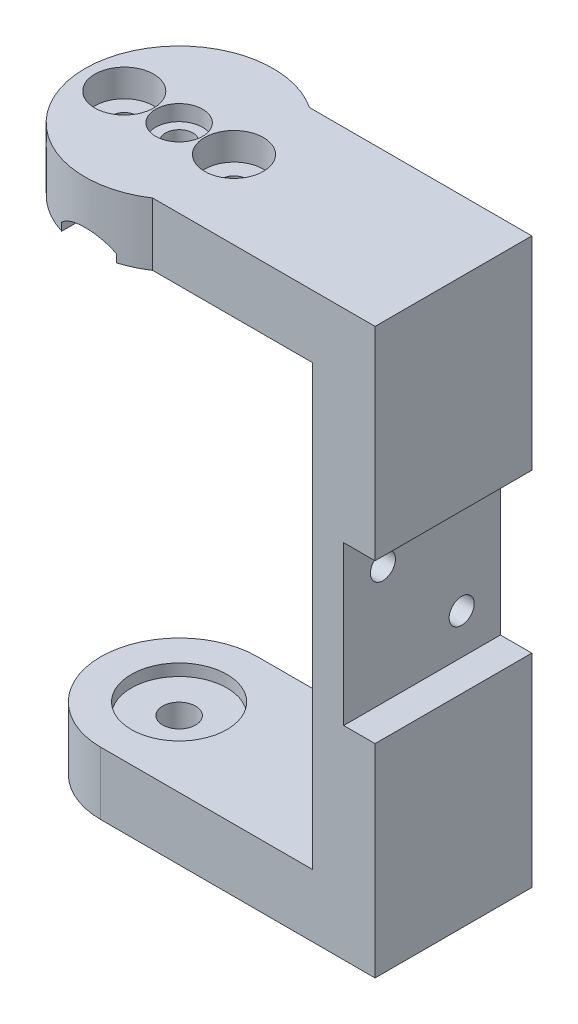
from build123d import *

# Parameters (mm, degrees)
SZKIC1_W                        = 45
SZKIC1_H                        = 20
SZKIC1_R                        = 2.1
DODANIE_WYCI_GNI_CIE1_DEPTH     = 8
SZKIC2_R                        = 6.1
WYTNIJ_WYCI_GNI_CIE1_DEPTH      = 1.5
WYTNIJ_WYCI_GNI_CIE2_START      = -1.5
SZKIC3_R                        = 6.1
WYTNIJ_WYCI_GNI_CIE2_DEPTH      = 1.5
SZKIC4_W                        = 8
SZKIC4_H                        = 20
DODANIE_WYCI_GNI_CIE2_DEPTH     = 56
ZAOKR_GLENIE1_R                 = 10
DODANIE_WYCI_GNI_CIE3_DEPTH     = 8
WYTNIJ_WYCI_GNI_CIE3_REACH      = 82.951
SZKIC6_R                        = 1.6
SZKIC7_R                        = 3.75
WYTNIJ_WYCI_GNI_CIE4_DEPTH      = 3.5
WYTNIJ_WYCI_GNI_CIE5_REACH      = 85.576
WYTNIJ_WYCI_GNI_CIE5_END_RADIUS = 12
SZKIC10_R                       = 3
WYTNIJ_WYCI_GNI_CIE6_DEPTH      = 2
WYTNIJ_WYCI_GNI_CIE7_REACH      = 81.177
WYTNIJ_WYCI_GNI_CIE7_END_RADIUS = 5
SZKIC11_R                       = 1.75
SZKIC12_W                       = 20
SZKIC12_H                       = 20.2
WYTNIJ_WYCI_GNI_CIE8_DEPTH      = 4
WYTNIJ_WYCI_GNI_CIE9_REACH      = 86.717
SZKIC13_R                       = 1.6
SZKIC14_R                       = 3.75
WYTNIJ_WYCI_GNI_CIE10_DEPTH     = 1


with BuildPart() as part:
    # Szkic1 → Dodanie-wyciągnięcie1 (new body)
    with BuildSketch(Plane(origin=(0, 0, 0), x_dir=(1, 0, 0), z_dir=(0, 1, 0))):
        with Locations((12.5, 0)):
            Rectangle(SZKIC1_W, SZKIC1_H)
        with Locations(Location((0, 0, 0), (0, 0, 270))):
            Circle(SZKIC1_R, mode=Mode.SUBTRACT)
    extrude(amount=DODANIE_WYCI_GNI_CIE1_DEPTH)

    # Szkic2 → Wytnij-wyciągnięcie1 (cut)
    with BuildSketch(Plane(origin=(0, 8, 0), x_dir=(1, 0, 0), z_dir=(0, 1, 0))):
        with Locations(Location((0, 0, 0), (0, 0, 270))):
            Circle(SZKIC2_R)
    extrude(amount=-WYTNIJ_WYCI_GNI_CIE1_DEPTH, mode=Mode.SUBTRACT)

    # Szkic3 → Wytnij-wyciągnięcie2 (cut)
    with BuildSketch(Plane.XZ.offset(WYTNIJ_WYCI_GNI_CIE2_START)):
        with Locations(Location((0, 0, 0), (0, 0, 90))):
            Circle(SZKIC3_R)
    extrude(amount=WYTNIJ_WYCI_GNI_CIE2_DEPTH, mode=Mode.SUBTRACT)

    # Szkic4 → Dodanie-wyciągnięcie2 (add)
    with BuildSketch(Plane(origin=(0, 8, 0), x_dir=(1, 0, 0), z_dir=(0, 1, 0))):
        with Locations((31, 0)):
            Rectangle(SZKIC4_W, SZKIC4_H)
    extrude(amount=DODANIE_WYCI_GNI_CIE2_DEPTH)

    # Zaokrąglenie1
    zaokr_glenie1_edges = [part.edges().sort_by_distance(p)[0] for p in [
        (-10, 4, -10),
        (-10, 4, 10),
    ]]
    fillet(zaokr_glenie1_edges, radius=ZAOKR_GLENIE1_R - 0.0001)  # a hair under: the kernel refuses the full size

    # Szkic5 → Dodanie-wyciągnięcie3 (add)
    with BuildSketch(Plane(origin=(0, 64, 0), x_dir=(1, 0, 0), z_dir=(0, 1, 0))):
        with BuildLine():
            Line((35, -10), (35, 10))
            Line((35, 10), (6.633249581, 10))
            ThreePointArc((6.633249581, 10), (-12, 0), (6.633249581, -10))
            Line((6.633249581, -10), (35, -10))
        make_face()
    extrude(amount=DODANIE_WYCI_GNI_CIE3_DEPTH)

    # Szkic6 → Wytnij-wyciągnięcie3 (cut, up to next)
    with BuildSketch(Plane(origin=(0, 72, 0), x_dir=(1, 0, 0), z_dir=(0, 1, 0)), mode=Mode.PRIVATE) as wytnij_wyci_gni_cie3_sk1:
        with Locations(Location((-7, 0, 0), (0, 0, 270))):
            Circle(SZKIC6_R)
    wytnij_wyci_gni_cie3_tool1 = extrude(wytnij_wyci_gni_cie3_sk1.sketch, amount=-WYTNIJ_WYCI_GNI_CIE3_REACH, mode=Mode.PRIVATE) & part.part
    # Szkic6 → Wytnij-wyciągnięcie3 (cut, up to next)
    with BuildSketch(Plane(origin=(0, 72, 0), x_dir=(1, 0, 0), z_dir=(0, 1, 0)), mode=Mode.PRIVATE) as wytnij_wyci_gni_cie3_sk2:
        with Locations(Location((7, 0, 0), (0, 0, 270))):
            Circle(SZKIC6_R)
    wytnij_wyci_gni_cie3_tool2 = extrude(wytnij_wyci_gni_cie3_sk2.sketch, amount=-WYTNIJ_WYCI_GNI_CIE3_REACH, mode=Mode.PRIVATE) & part.part
    add(wytnij_wyci_gni_cie3_tool1.solids().sort_by_distance((-7, 72, 0))[0], mode=Mode.SUBTRACT)
    add(wytnij_wyci_gni_cie3_tool2.solids().sort_by_distance((7, 72, 0))[0], mode=Mode.SUBTRACT)

    # Szkic7 → Wytnij-wyciągnięcie4 (cut)
    with BuildSketch(Plane(origin=(0, 72, 0), x_dir=(1, 0, 0), z_dir=(0, 1, 0))):
        with Locations(Location((7, 0, 0), (0, 0, 270))):
            Circle(SZKIC7_R)
        with Locations(Location((-7, 0, 0), (0, 0, 270))):
            Circle(SZKIC7_R)
    extrude(amount=-WYTNIJ_WYCI_GNI_CIE4_DEPTH, mode=Mode.SUBTRACT)

    # Wytnij-wyciągnięcie5: up to this cylinder (the profile starts inside it)
    wytnij_wyci_gni_cie5_end = Plane(origin=(0, 65.035303, 0), z_dir=(0, -1, 0)) * Cylinder(WYTNIJ_WYCI_GNI_CIE5_END_RADIUS, 196.152, mode=Mode.PRIVATE)
    # Szkic9 → Wytnij-wyciągnięcie5 (cut, up to the surface)
    with BuildSketch(Plane.XY.offset(12), mode=Mode.PRIVATE) as wytnij_wyci_gni_cie5_sk1:
        with BuildLine():
            Line((-3.5, 64), (3.5, 64))
            Line((3.5, 64), (3.5, 65))
            ThreePointArc((3.5, 65), (0, 66.429285786), (-3.5, 65))
            Line((-3.5, 65), (-3.5, 64))
        make_face()
    wytnij_wyci_gni_cie5_tool1 = extrude(wytnij_wyci_gni_cie5_sk1.sketch, amount=-WYTNIJ_WYCI_GNI_CIE5_REACH, mode=Mode.PRIVATE) & wytnij_wyci_gni_cie5_end
    add(wytnij_wyci_gni_cie5_tool1.solids().sort_by_distance((0, 65.035303, 12))[0], mode=Mode.SUBTRACT)

    # Szkic10 → Wytnij-wyciągnięcie6 (cut)
    with BuildSketch(Plane(origin=(0, 72, 0), x_dir=(1, 0, 0), z_dir=(0, 1, 0))):
        with Locations(Location((0, 0, 0), (0, 0, 270))):
            Circle(SZKIC10_R)
    extrude(amount=-WYTNIJ_WYCI_GNI_CIE6_DEPTH, mode=Mode.SUBTRACT)

    # Wytnij-wyciągnięcie7: up to this cylinder (the profile starts outside it)
    wytnij_wyci_gni_cie7_end = Plane(origin=(0, 61.429285786, 0), z_dir=(0, 0, 1)) * Cylinder(WYTNIJ_WYCI_GNI_CIE7_END_RADIUS, 173.354, mode=Mode.PRIVATE)
    # Szkic11 → Wytnij-wyciągnięcie7 (cut, up to the surface)
    with BuildSketch(Plane(origin=(0, 70, 0), x_dir=(1, 0, 0), z_dir=(0, 1, 0)), mode=Mode.PRIVATE) as wytnij_wyci_gni_cie7_sk1:
        with Locations(Location((0, 0, 0), (0, 0, 270))):
            Circle(SZKIC11_R)
    wytnij_wyci_gni_cie7_tool1 = extrude(wytnij_wyci_gni_cie7_sk1.sketch, amount=-WYTNIJ_WYCI_GNI_CIE7_REACH, mode=Mode.PRIVATE) - wytnij_wyci_gni_cie7_end
    add(wytnij_wyci_gni_cie7_tool1.solids().sort_by_distance((0, 70, 0))[0], mode=Mode.SUBTRACT)

    # Szkic12 → Wytnij-wyciągnięcie8 (cut)
    with BuildSketch(Plane(origin=(35, 0, 0), x_dir=(0, 0, -1), z_dir=(1, 0, 0))):
        with Locations((0, 36)):
            Rectangle(SZKIC12_W, SZKIC12_H)
    extrude(amount=-WYTNIJ_WYCI_GNI_CIE8_DEPTH, mode=Mode.SUBTRACT)

    # Szkic13 → Wytnij-wyciągnięcie9 (cut, up to next)
    with BuildSketch(Plane(origin=(31, 0, 0), x_dir=(0, 0, -1), z_dir=(1, 0, 0)), mode=Mode.PRIVATE) as wytnij_wyci_gni_cie9_sk1:
        with Locations((-5, 41)):
            Circle(SZKIC13_R)
    wytnij_wyci_gni_cie9_tool1 = extrude(wytnij_wyci_gni_cie9_sk1.sketch, amount=-WYTNIJ_WYCI_GNI_CIE9_REACH, mode=Mode.PRIVATE) & part.part
    # Szkic13 → Wytnij-wyciągnięcie9 (cut, up to next)
    with BuildSketch(Plane(origin=(31, 0, 0), x_dir=(0, 0, -1), z_dir=(1, 0, 0)), mode=Mode.PRIVATE) as wytnij_wyci_gni_cie9_sk2:
        with Locations((5.0495025, 31.049997525)):
            Circle(SZKIC13_R)
    wytnij_wyci_gni_cie9_tool2 = extrude(wytnij_wyci_gni_cie9_sk2.sketch, amount=-WYTNIJ_WYCI_GNI_CIE9_REACH, mode=Mode.PRIVATE) & part.part
    add(wytnij_wyci_gni_cie9_tool1.solids().sort_by_distance((31, 41, 5))[0], mode=Mode.SUBTRACT)
    add(wytnij_wyci_gni_cie9_tool2.solids().sort_by_distance((31, 31.049998, -5.049502))[0], mode=Mode.SUBTRACT)

    # Szkic14 → Wytnij-wyciągnięcie10 (cut)
    with BuildSketch(Plane.ZY.offset(-27)):
        with Locations((5, 41)):
            Circle(SZKIC14_R)
        with Locations((-5.0495025, 31.049997525)):
            Circle(SZKIC14_R)
    extrude(amount=-WYTNIJ_WYCI_GNI_CIE10_DEPTH, mode=Mode.SUBTRACT)


solid = part.part
